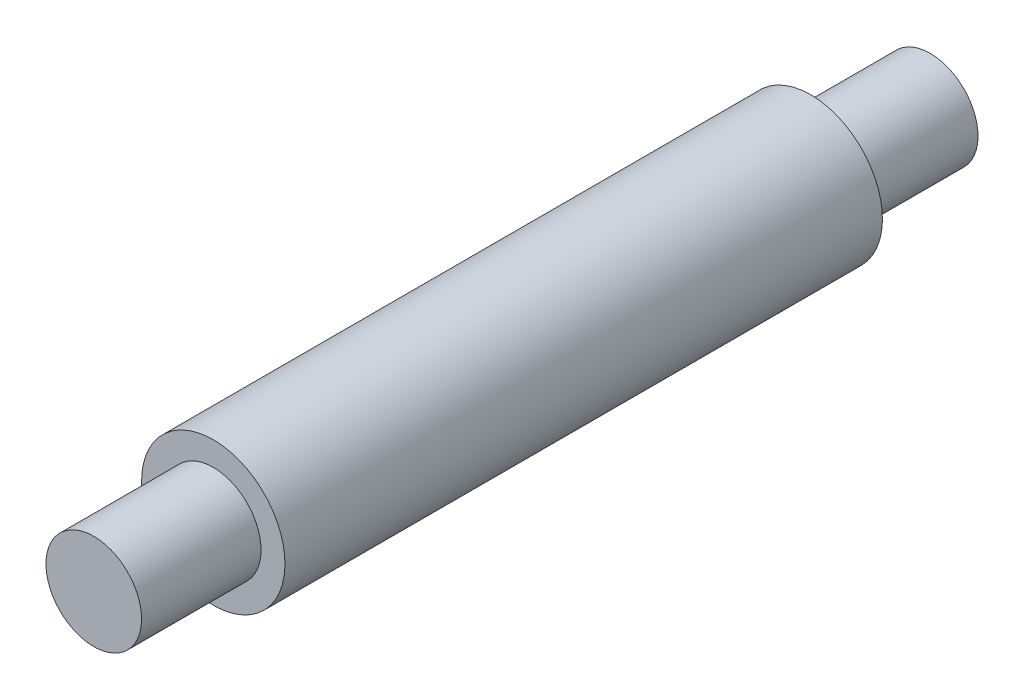
from build123d import *


with BuildPart() as part:
    # Sketch1 → Revolve1 (revolve)
    with BuildSketch(Plane(origin=(0, 0, 0), x_dir=(0, 0, -1), z_dir=(1, 0, 0))):
        Polygon((-10, 0), (-10, 4), (0, 4), (0, 6), (50, 6), (50, 4), (60, 4), (60, 0), align=None)
    revolve(axis=Axis((0, 0, -60), (0, 0, 1)))


solid = part.part
